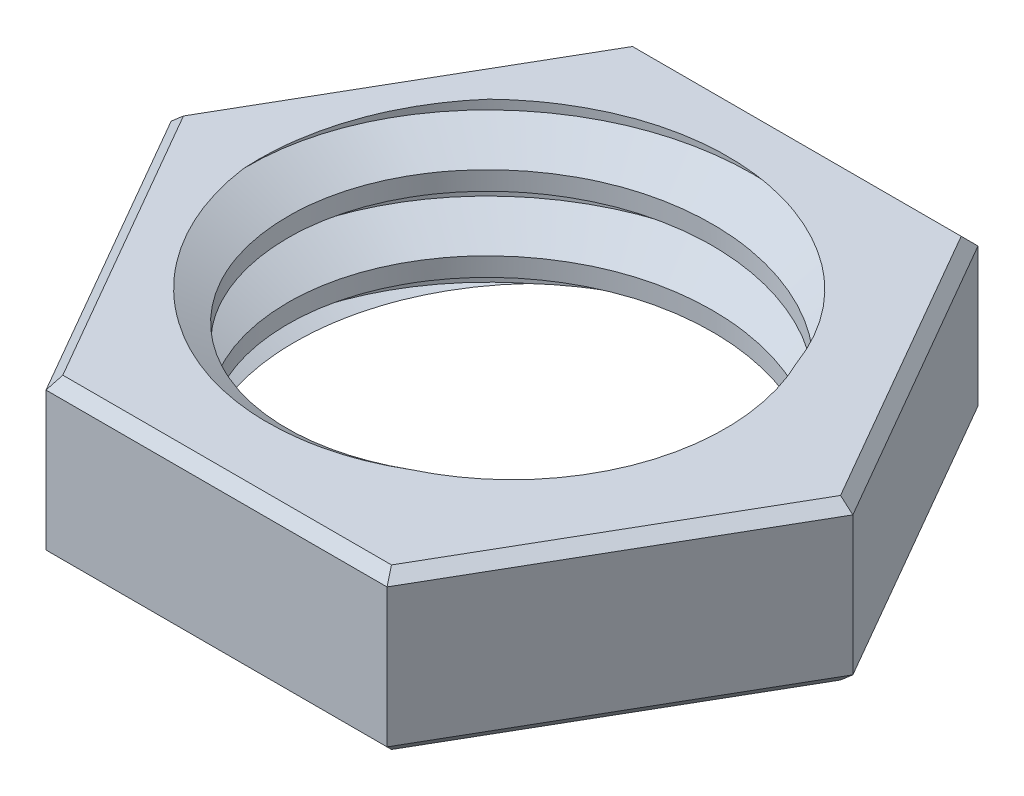
from build123d import *

# Parameters (mm, degrees)
SKETCH1_R           = 2
BOSS_EXTRUDE1_DEPTH = 1.5
CHAMFER1_SIZE       = 0.1
THREAD1_PITCH       = 0.7


with BuildPart() as part:
    # Sketch1 → Boss-Extrude1 (new body)
    with BuildSketch(Plane(origin=(0, 0, 0), x_dir=(1, 0, 0), z_dir=(0, 1, 0))):
        Polygon((-4.667219818, 14.160060238), (-1.467219818, 14.160060238), (0.130801183, 11.387637311), (-1.469198817, 8.616356019), (-4.669198817, 8.616356019), (-6.267219818, 11.388778946), align=None)
        with Locations(Location((-3.068209317, 11.388208128, 0), (0, 0, 270))):
            Circle(SKETCH1_R, mode=Mode.SUBTRACT)
    extrude(amount=BOSS_EXTRUDE1_DEPTH)

    # Chamfer1
    chamfer1_edges = [part.edges().sort_by_distance(p)[0] for p in [
        (-3.069198817, 1.5, -8.616356019),
        (-0.669198817, 1.5, -10.001996665),
        (-0.668209317, 1.5, -12.773848775),
        (-3.067219818, 1.5, -14.160060238),
        (-5.467219818, 1.5, -12.774419592),
        (-3.067219818, 0, -14.160060238),
        (-0.668209317, 0, -12.773848775),
        (-0.669198817, 0, -10.001996665),
        (-3.069198817, 0, -8.616356019),
        (-5.468209317, 0, -10.002567482),
        (-5.467219818, 0, -12.774419592),
        (-5.468209317, 1.5, -10.002567482),
    ]]
    chamfer(chamfer1_edges, length=CHAMFER1_SIZE)

    # Thread1: the profile of Thread Profile1 profile screwed along a right-hand helix of 21.985714 turns, 6 arcs to a turn; built about Z, then put on its axis
    thread1_z = Axis((0, 0, 0), (0, 0, 1))
    thread1_corners = [(1.9997, 0, -0.000173205), (2.378886113, 0, 0.218749999), (2.378886113, 0, 0.306249999), (1.9997, 0, 0.525173203)]
    with BuildLine(mode=Mode.PRIVATE) as thread1_profile:
        Line(thread1_corners[0], thread1_corners[1])
        Line(thread1_corners[1], thread1_corners[2])
        Line(thread1_corners[2], thread1_corners[3])
        Line(thread1_corners[3], thread1_corners[0])
    thread1_cap = Face(thread1_profile.wire())
    thread1_turn_angles = [0, 30, 60, 90, 120, 150, 180, 210, 240, 270, 300, 330, 360]
    thread1_turn_weights = [1, 0.8660254037844387, 1, 0.8660254037844387, 1, 0.8660254037844387, 1, 0.8660254037844387, 1, 0.8660254037844387, 1, 0.8660254037844387, 1]
    thread1_turn_rails = [Edge.make_bspline([Vector(p[0], p[1], 0).rotate(thread1_z, thread1_turn_angles[k]) / thread1_turn_weights[k] + Vector(0, 0, p[2] + THREAD1_PITCH * thread1_turn_angles[k] / 360) for k in range(13)], [0, 0, 0, 1, 1, 2, 2, 3, 3, 4, 4, 5, 5, 6, 6, 6], 2, thread1_turn_weights) for p in thread1_corners]
    thread1_turn_sides = [Face.make_surface_from_curves(thread1_turn_rails[p[0]], thread1_turn_rails[p[1]]) for p in [(0, 1), (1, 2), (2, 3), (3, 0)]]
    thread1_last_angles = [7560, 7590, 7620, 7650, 7680, 7710, 7740, 7770, 7800, 7830, 7860, 7887.428571429, 7914.857142857]
    thread1_last_weights = [1, 0.8660254037844387, 1, 0.8660254037844387, 1, 0.8660254037844387, 1, 0.8660254037844387, 1, 0.8660254037844387, 1, 0.8875857890045493, 1]
    thread1_last_rails = [Edge.make_bspline([Vector(p[0], p[1], 0).rotate(thread1_z, thread1_last_angles[k]) / thread1_last_weights[k] + Vector(0, 0, p[2] + THREAD1_PITCH * thread1_last_angles[k] / 360) for k in range(13)], [0, 0, 0, 1, 1, 2, 2, 3, 3, 4, 4, 5, 5, 6, 6, 6], 2, thread1_last_weights) for p in thread1_corners]
    thread1_last_sides = [Face.make_surface_from_curves(thread1_last_rails[p[0]], thread1_last_rails[p[1]]) for p in [(0, 1), (1, 2), (2, 3), (3, 0)]]
    thread1 = Plane(origin=(-3.068209317, 2.5, -11.388208128), x_dir=(-1, 0, 0), z_dir=(0, -1, 0)) * Solid(Shell([*[p.moved(Location((0, 0, THREAD1_PITCH * i))) for i in range(21) for p in thread1_turn_sides], *thread1_last_sides, thread1_cap, thread1_cap.rotate(thread1_z, 7914.857142857).moved(Location((0, 0, THREAD1_PITCH * 7914.857142857 / 360)))]))
    add(thread1, mode=Mode.SUBTRACT)


solid = part.part
